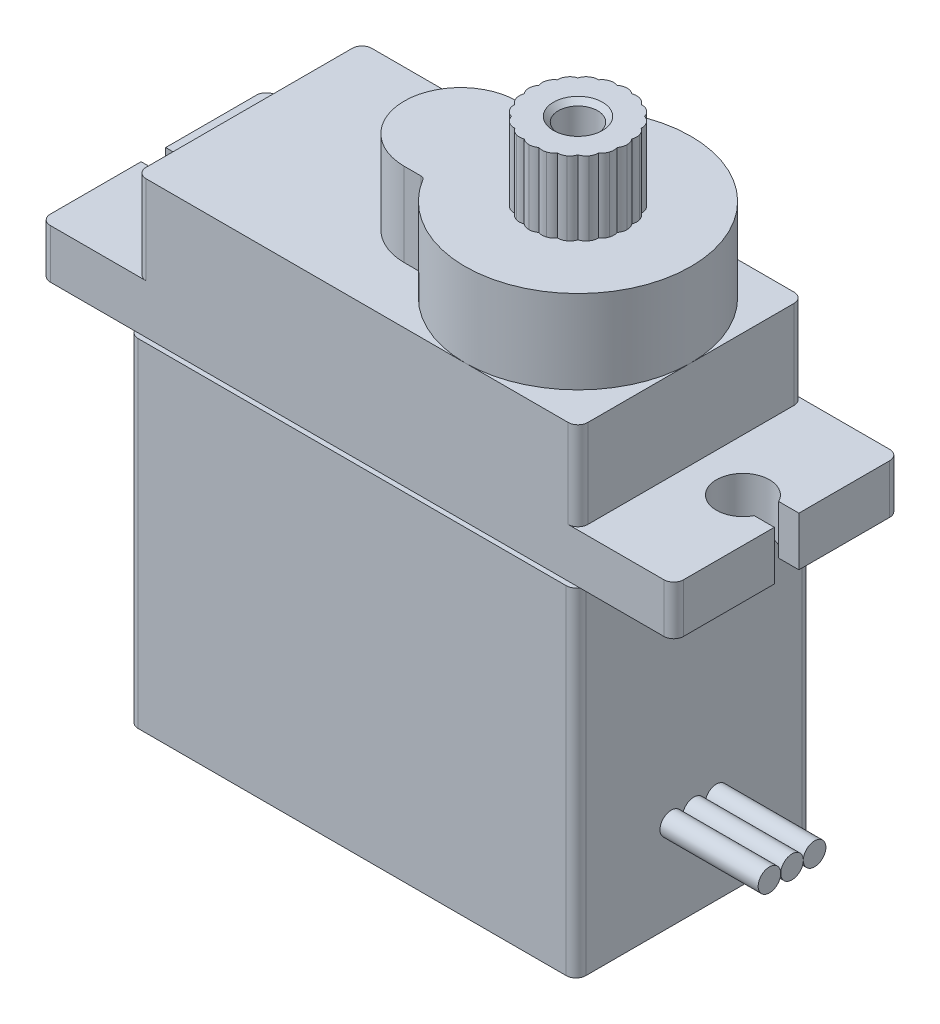
from build123d import *

# Parameters (mm, degrees)
SKETCH1_W           = 22.8
SKETCH1_H           = 12
BOSS_EXTRUDE1_DEPTH = 17.2
BOSS_EXTRUDE2_DEPTH = 2.5
SKETCH3_W           = 22.5
SKETCH3_H           = 11.5
BOSS_EXTRUDE3_DEPTH = 4.5
BOSS_EXTRUDE4_DEPTH = 4.25
SKETCH5_R           = 1
BOSS_EXTRUDE5_DEPTH = 3.75
CHAMFER1_SIZE       = 0.25
FILLET1_R           = 0.5
SKETCH7_R           = 0.575
BOSS_EXTRUDE6_DEPTH = 5
SKETCH7_3_R         = 0.575
BOSS_EXTRUDE7_DEPTH = 5
SKETCH7_4_R         = 0.575
BOSS_EXTRUDE8_DEPTH = 5


with BuildPart() as part:
    # Sketch1 → Boss-Extrude1 (new body)
    with BuildSketch(Plane(origin=(0, 0, 0), x_dir=(1, 0, 0), z_dir=(0, 1, 0))):
        Rectangle(SKETCH1_W, SKETCH1_H)
    extrude(amount=BOSS_EXTRUDE1_DEPTH)

    # Sketch2 → Boss-Extrude2 (add)
    with BuildSketch(Plane(origin=(0, 17.2, 0), x_dir=(1, 0, 0), z_dir=(0, 1, 0))):
        with BuildLine():
            Line((-16.125, -5.75), (16.125, -5.75))
            Line((16.125, -5.75), (16.125, -0.625))
            Line((16.125, -0.625), (15.096609794, -0.625))
            ThreePointArc((15.096609794, -0.625), (12.55, 0), (15.096609794, 0.625))
            Line((15.096609794, 0.625), (16.125, 0.625))
            Line((16.125, 0.625), (16.125, 5.75))
            Line((16.125, 5.75), (-16.125, 5.75))
            Line((-16.125, 5.75), (-16.125, 0.625))
            Line((-16.125, 0.625), (-15.096609794, 0.625))
            ThreePointArc((-15.096609794, 0.625), (-12.55, 0), (-15.096609794, -0.625))
            Line((-15.096609794, -0.625), (-16.125, -0.625))
            Line((-16.125, -0.625), (-16.125, -5.75))
        make_face()
    extrude(amount=BOSS_EXTRUDE2_DEPTH)

    # Sketch3 → Boss-Extrude3 (add)
    with BuildSketch(Plane(origin=(0, 19.7, 0), x_dir=(1, 0, 0), z_dir=(0, 1, 0))):
        Rectangle(SKETCH3_W, SKETCH3_H)
    extrude(amount=BOSS_EXTRUDE3_DEPTH)

    # Sketch4 → Boss-Extrude4 (add)
    with BuildSketch(Plane(origin=(0, 24.2, 0), x_dir=(1, 0, 0), z_dir=(0, 1, 0))):
        with BuildLine():
            Line((-0.475, 2.875), (0.378049688, 2.875))
            ThreePointArc((0.378049688, 2.875), (0.500417814, 2.906995317), (0.591464284, 2.994791667))
            ThreePointArc((0.591464284, 2.994791667), (11.25, 0), (0.591464284, -2.994791667))
            ThreePointArc((0.591464284, -2.994791667), (0.500417814, -2.906995317), (0.378049688, -2.875))
            Line((0.378049688, -2.875), (-0.475, -2.875))
            ThreePointArc((-0.475, -2.875), (-3.35, 0), (-0.475, 2.875))
        make_face()
    extrude(amount=BOSS_EXTRUDE4_DEPTH)

    # Fillet1
    # the kernel refuses this fillet: 0.5 mm, written as the material it takes off along each edge
    with BuildSketch(Plane(origin=(16.125, 15.95, -5.75), x_dir=(-1, 0, 0), z_dir=(0, 1, 0)), Plane(origin=(-16.125, 15.95, 5.75), x_dir=(1, 0, 0), z_dir=(0, 1, 0))) as fillet1_piece_1:
        with BuildLine():
            CenterArc((FILLET1_R, FILLET1_R), FILLET1_R, 180, 90)
            Line((0, FILLET1_R), (0, 0))
            Line((0, 0), (FILLET1_R, 0))
        make_face()
    extrude(amount=5, mode=Mode.SUBTRACT)
    with BuildSketch(Plane(origin=(-16.125, 15.95, -5.75), x_dir=(1, 0, 0), z_dir=(0, 1, 0)), Plane(origin=(16.125, 15.95, 5.75), x_dir=(-1, 0, 0), z_dir=(0, 1, 0))) as fillet1_piece_2:
        with BuildLine():
            CenterArc((FILLET1_R, -FILLET1_R), FILLET1_R, 90, 90)
            Line((0, -FILLET1_R), (0, 0))
            Line((0, 0), (FILLET1_R, 0))
        make_face()
    extrude(amount=5, mode=Mode.SUBTRACT)
    with BuildSketch(Plane(origin=(11.25, 19.7, 5.75), x_dir=(-1, 0, 0), z_dir=(0, 1, 0)), Plane(origin=(-11.25, 19.7, -5.75), x_dir=(1, 0, 0), z_dir=(0, 1, 0))) as fillet1_piece_3:
        with BuildLine():
            CenterArc((FILLET1_R, -FILLET1_R), FILLET1_R, 90, 90)
            Line((0, -FILLET1_R), (0, 0))
            Line((0, 0), (FILLET1_R, 0))
        make_face()
    extrude(amount=5.75, mode=Mode.SUBTRACT)
    with BuildSketch(Plane(origin=(11.25, 19.7, -5.75), x_dir=(-1, 0, 0), z_dir=(0, 1, 0)), Plane(origin=(-11.25, 19.7, 5.75), x_dir=(1, 0, 0), z_dir=(0, 1, 0))) as fillet1_piece_4:
        with BuildLine():
            CenterArc((FILLET1_R, FILLET1_R), FILLET1_R, 180, 90)
            Line((0, FILLET1_R), (0, 0))
            Line((0, 0), (FILLET1_R, 0))
        make_face()
    extrude(amount=5.75, mode=Mode.SUBTRACT)
    with BuildSketch(Plane(origin=(11.4, -1.25, 6), x_dir=(-1, 0, 0), z_dir=(0, 1, 0)), Plane(origin=(11.4, -1.25, -6), x_dir=(0, 0, 1), z_dir=(0, 1, 0))) as fillet1_piece_5:
        with BuildLine():
            CenterArc((FILLET1_R, -FILLET1_R), FILLET1_R, 90, 90)
            Line((0, -FILLET1_R), (0, 0))
            Line((0, 0), (FILLET1_R, 0))
        make_face()
    extrude(amount=18.45, mode=Mode.SUBTRACT)
    with BuildSketch(Plane(origin=(-11.4, -1.25, 6), x_dir=(1, 0, 0), z_dir=(0, 1, 0)), Plane(origin=(-11.4, -1.25, -6), x_dir=(0, 0, 1), z_dir=(0, 1, 0))) as fillet1_piece_6:
        with BuildLine():
            CenterArc((FILLET1_R, FILLET1_R), FILLET1_R, 180, 90)
            Line((0, FILLET1_R), (0, 0))
            Line((0, 0), (FILLET1_R, 0))
        make_face()
    extrude(amount=18.45, mode=Mode.SUBTRACT)


with BuildPart() as body_2:
    # Sketch5 → Boss-Extrude5 (new body)
    with BuildSketch(Plane(origin=(0, 28.45, 0), x_dir=(1, 0, 0), z_dir=(0, 1, 0))):
        with BuildLine():
            ThreePointArc((3.135664935, 0.374473886), (3.036207488, 0.199165651), (3.005259069, 0))
            ThreePointArc((3.005259069, 0), (3.036207488, -0.199165651), (3.135664935, -0.374473886))
            ThreePointArc((3.135664935, -0.374473886), (3.095248505, -0.571935967), (3.127360381, -0.770917344))
            ThreePointArc((3.127360381, -0.770917344), (3.218339647, -0.950771547), (3.367102524, -1.086765545))
            ThreePointArc((3.367102524, -1.086765545), (3.389683354, -1.287052507), (3.481712191, -1.466371927))
            ThreePointArc((3.481712191, -1.466371927), (3.623816619, -1.6093093), (3.807322979, -1.692677021))
            ThreePointArc((3.807322979, -1.692677021), (3.8906907, -1.876183381), (4.033628073, -2.018287809))
            ThreePointArc((4.033628073, -2.018287809), (4.212947493, -2.110316646), (4.413234455, -2.132897476))
            ThreePointArc((4.413234455, -2.132897476), (4.549228453, -2.281660353), (4.729082656, -2.372639619))
            ThreePointArc((4.729082656, -2.372639619), (4.928064033, -2.404751495), (5.125526114, -2.364335065))
            ThreePointArc((5.125526114, -2.364335065), (5.300834349, -2.463792512), (5.5, -2.494740931))
            ThreePointArc((5.5, -2.494740931), (5.699165651, -2.463792512), (5.874473886, -2.364335065))
            ThreePointArc((5.874473886, -2.364335065), (6.071935967, -2.404751495), (6.270917344, -2.372639619))
            ThreePointArc((6.270917344, -2.372639619), (6.450771547, -2.281660353), (6.586765545, -2.132897476))
            ThreePointArc((6.586765545, -2.132897476), (6.787052507, -2.110316646), (6.966371927, -2.018287809))
            ThreePointArc((6.966371927, -2.018287809), (7.1093093, -1.876183381), (7.192677021, -1.692677021))
            ThreePointArc((7.192677021, -1.692677021), (7.376183381, -1.6093093), (7.518287809, -1.466371927))
            ThreePointArc((7.518287809, -1.466371927), (7.610316646, -1.287052507), (7.632897476, -1.086765545))
            ThreePointArc((7.632897476, -1.086765545), (7.781660353, -0.950771547), (7.872639619, -0.770917344))
            ThreePointArc((7.872639619, -0.770917344), (7.904751495, -0.571935967), (7.864335065, -0.374473886))
            ThreePointArc((7.864335065, -0.374473886), (7.963792512, -0.199165651), (7.994740931, 0))
            ThreePointArc((7.994740931, 0), (7.963792512, 0.199165651), (7.864335065, 0.374473886))
            ThreePointArc((7.864335065, 0.374473886), (7.904751495, 0.571935967), (7.872639619, 0.770917344))
            ThreePointArc((7.872639619, 0.770917344), (7.781660353, 0.950771547), (7.632897476, 1.086765545))
            ThreePointArc((7.632897476, 1.086765545), (7.610316646, 1.287052507), (7.518287809, 1.466371927))
            ThreePointArc((7.518287809, 1.466371927), (7.376183381, 1.6093093), (7.192677021, 1.692677021))
            ThreePointArc((7.192677021, 1.692677021), (7.1093093, 1.876183381), (6.966371927, 2.018287809))
            ThreePointArc((6.966371927, 2.018287809), (6.787052507, 2.110316646), (6.586765545, 2.132897476))
            ThreePointArc((6.586765545, 2.132897476), (6.450771547, 2.281660353), (6.270917344, 2.372639619))
            ThreePointArc((6.270917344, 2.372639619), (6.071935967, 2.404751495), (5.874473886, 2.364335065))
            ThreePointArc((5.874473886, 2.364335065), (5.699165651, 2.463792512), (5.5, 2.494740931))
            ThreePointArc((5.5, 2.494740931), (5.300834349, 2.463792512), (5.125526114, 2.364335065))
            ThreePointArc((5.125526114, 2.364335065), (4.928064033, 2.404751495), (4.729082656, 2.372639619))
            ThreePointArc((4.729082656, 2.372639619), (4.549228453, 2.281660353), (4.413234455, 2.132897476))
            ThreePointArc((4.413234455, 2.132897476), (4.212947493, 2.110316646), (4.033628073, 2.018287809))
            ThreePointArc((4.033628073, 2.018287809), (3.8906907, 1.876183381), (3.807322979, 1.692677021))
            ThreePointArc((3.807322979, 1.692677021), (3.623816619, 1.6093093), (3.481712191, 1.466371927))
            ThreePointArc((3.481712191, 1.466371927), (3.389683354, 1.287052507), (3.367102524, 1.086765545))
            ThreePointArc((3.367102524, 1.086765545), (3.218339647, 0.950771547), (3.127360381, 0.770917344))
            ThreePointArc((3.127360381, 0.770917344), (3.095248505, 0.571935967), (3.135664935, 0.374473886))
        make_face()
        with Locations(Location((5.5, 0, 0), (0, 0, 270))):
            Circle(SKETCH5_R, mode=Mode.SUBTRACT)
    extrude(amount=BOSS_EXTRUDE5_DEPTH)

    # Chamfer1
    chamfer1_edges = [body_2.edges().sort_by_distance(p)[0] for p in [
        (5.5, 32.2, -1),
    ]]
    chamfer(chamfer1_edges, length=CHAMFER1_SIZE)


with BuildPart() as body_3:
    # Sketch7 → Boss-Extrude6 (new body)
    with BuildSketch(Plane(origin=(11.4, 0, 0), x_dir=(0, 0, -1), z_dir=(1, 0, 0))):
        with Locations((-1.15, 4.55)):
            Circle(SKETCH7_R)
    extrude(amount=BOSS_EXTRUDE6_DEPTH)


with BuildPart() as body_4:
    # Sketch7<3> → Boss-Extrude7 (new body)
    with BuildSketch(Plane(origin=(11.4, 0, 0), x_dir=(0, 0, -1), z_dir=(1, 0, 0))):
        with Locations((0, 4.55)):
            Circle(SKETCH7_3_R)
    extrude(amount=BOSS_EXTRUDE7_DEPTH)


with BuildPart() as body_5:
    # Sketch7<4> → Boss-Extrude8 (new body)
    with BuildSketch(Plane(origin=(11.4, 0, 0), x_dir=(0, 0, -1), z_dir=(1, 0, 0))):
        with Locations((1.15, 4.55)):
            Circle(SKETCH7_4_R)
    extrude(amount=BOSS_EXTRUDE8_DEPTH)


solid = Compound([part.part, body_2.part, body_3.part, body_4.part, body_5.part])
